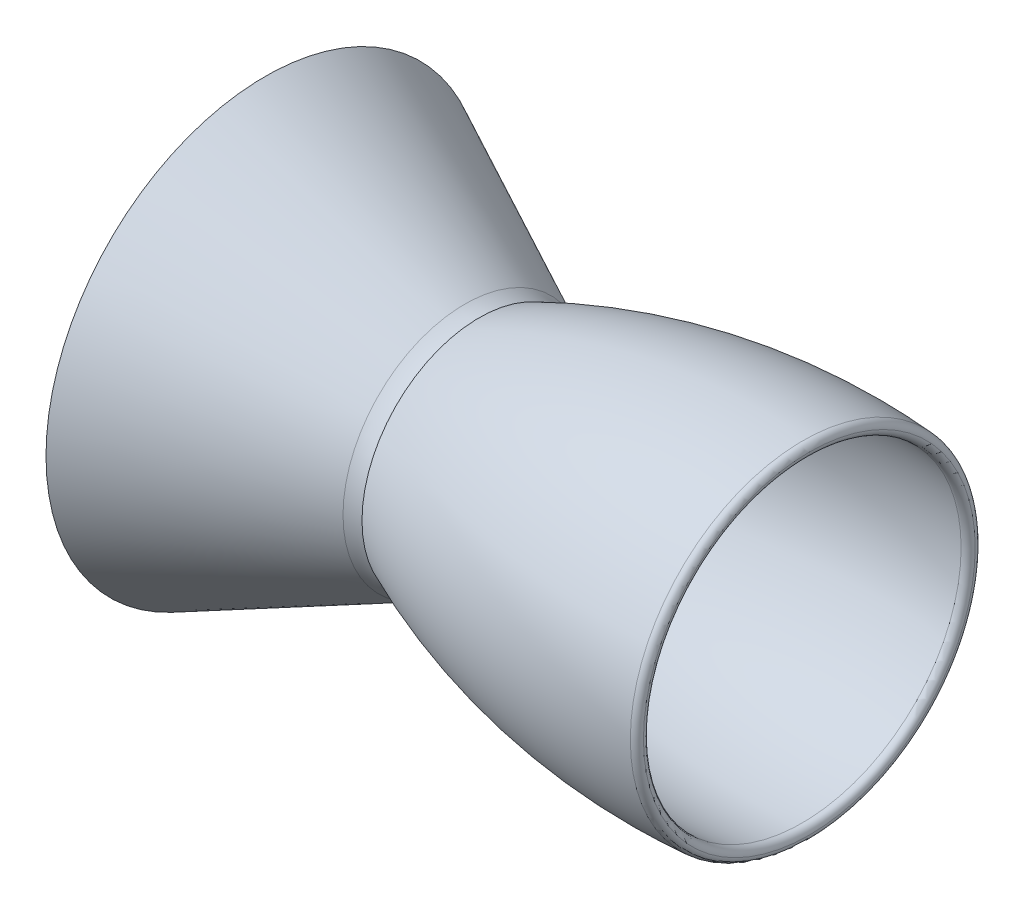
from build123d import *

# Parameters (mm, degrees)
FILLET1_R = 25


with BuildPart() as part:
    # Sketch1 → Revolve1 (revolve)
    with BuildSketch(Plane.XY, mode=Mode.PRIVATE) as revolve1_sk:
        with BuildLine():
            Line((-1000, 750), (-287.96738453, 402.947323104))
            ThreePointArc((-287.96738453, 402.947323104), (-248.23068853, 387.615384192), (-206.46810091, 379.25119654))
            ThreePointArc((-206.46810091, 379.25119654), (384.130769757, 555.909184123), (1000, 582.74501558))
            Line((1000, 582.74501558), (1000, 632.902298406))
            ThreePointArc((1000, 632.902298406), (380.914443639, 606.067618482), (-213.437966267, 430.76148915))
            ThreePointArc((-213.437966267, 430.76148915), (-240.344629809, 437.498198252), (-266.060496719, 447.892715153))
            Line((-266.060496719, 447.892715153), (-1000, 805.62305469))
            Line((-1000, 805.62305469), (-1000, 750))
        make_face()
    revolve(revolve1_sk.sketch.rotate(Axis((-150.527216967, 0, 0), (1, 0, 0)), 90), axis=Axis((-150.527216967, 0, 0), (1, 0, 0)))

    # Fillet1
    # the kernel refuses this fillet: 25 mm, written as the material it takes off along each edge
    with BuildSketch(Plane(origin=(1000, 0, 0), x_dir=(0, 0, 1), z_dir=(0, 1, 0))) as fillet1_piece_1:
        with BuildLine():
            CenterArc((609.684060703, -25), FILLET1_R, 3.96980258, 86.03019742)
            ThreePointArc((634.624077614, -23.269232412), (633.789791115, -11.632647741), (632.902298406, 0))
            Line((632.902298406, 0), (609.684060703, 0))
        make_face()
    revolve(axis=Axis((1000, 0, 0), (1, 0, 0)), mode=Mode.SUBTRACT)
    with BuildSketch(Plane(origin=(1000, 0, 0), x_dir=(0, 0, 1), z_dir=(0, 1, 0))) as fillet1_piece_2:
        with BuildLine():
            CenterArc((609.684060703, -25), FILLET1_R, 90, 93.96980258)
            Line((609.684060703, 0), (582.74501558, 0))
            ThreePointArc((582.74501558, 0), (583.780340457, -13.362705729), (584.744043791, -26.730767588))
        make_face()
    revolve(axis=Axis((1000, 0, 0), (1, 0, 0)), mode=Mode.SUBTRACT)


solid = part.part
